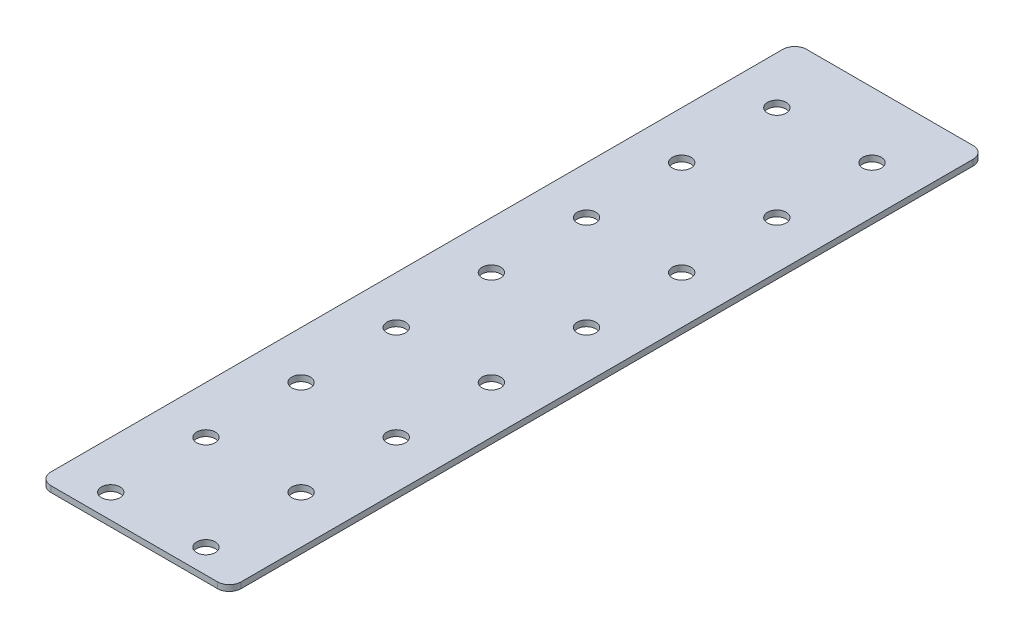
from build123d import *

# Parameters (mm, degrees)
SKETCH1_W           = 50.8
SKETCH1_H           = 201.72011345
SKETCH1_R           = 2.4892
BOSS_EXTRUDE1_DEPTH = 1.5875
FILLET1_R           = 3.175


with BuildPart() as part:
    # Sketch1 → Boss-Extrude1 (new body)
    with BuildSketch(Plane(origin=(0, 0, 0), x_dir=(1, 0, 0), z_dir=(0, 1, 0))):
        with Locations((25.4, 100.860056725)):
            Rectangle(SKETCH1_W, SKETCH1_H)
        with Locations((12.7, 6.457601766)):
            Circle(SKETCH1_R, mode=Mode.SUBTRACT)
        with Locations((12.7, 31.857601766)):
            Circle(SKETCH1_R, mode=Mode.SUBTRACT)
        with Locations((12.7, 57.257601766)):
            Circle(SKETCH1_R, mode=Mode.SUBTRACT)
        with Locations((12.7, 82.657601766)):
            Circle(SKETCH1_R, mode=Mode.SUBTRACT)
        with Locations((12.7, 108.057601766)):
            Circle(SKETCH1_R, mode=Mode.SUBTRACT)
        with Locations((12.7, 133.457601766)):
            Circle(SKETCH1_R, mode=Mode.SUBTRACT)
        with Locations((38.1, 31.857601766)):
            Circle(SKETCH1_R, mode=Mode.SUBTRACT)
        with Locations((38.1, 57.257601766)):
            Circle(SKETCH1_R, mode=Mode.SUBTRACT)
        with Locations((38.1, 82.657601766)):
            Circle(SKETCH1_R, mode=Mode.SUBTRACT)
        with Locations((38.1, 108.057601766)):
            Circle(SKETCH1_R, mode=Mode.SUBTRACT)
        with Locations((38.1, 133.457601766)):
            Circle(SKETCH1_R, mode=Mode.SUBTRACT)
        with Locations((38.1, 6.457601766)):
            Circle(SKETCH1_R, mode=Mode.SUBTRACT)
        with Locations((12.7, 158.857601766)):
            Circle(SKETCH1_R, mode=Mode.SUBTRACT)
        with Locations((12.7, 184.257601766)):
            Circle(SKETCH1_R, mode=Mode.SUBTRACT)
        with Locations((38.1, 158.857601766)):
            Circle(SKETCH1_R, mode=Mode.SUBTRACT)
        with Locations((38.1, 184.257601766)):
            Circle(SKETCH1_R, mode=Mode.SUBTRACT)
    extrude(amount=BOSS_EXTRUDE1_DEPTH)

    # Fillet1
    fillet1_edges = [part.edges().sort_by_distance(p)[0] for p in [
        (0, 0.79375, -201.72011345),
        (50.8, 0.79375, -201.72011345),
        (0, 0.79375, 0),
        (50.8, 0.79375, 0),
    ]]
    fillet(fillet1_edges, radius=FILLET1_R)


solid = part.part
